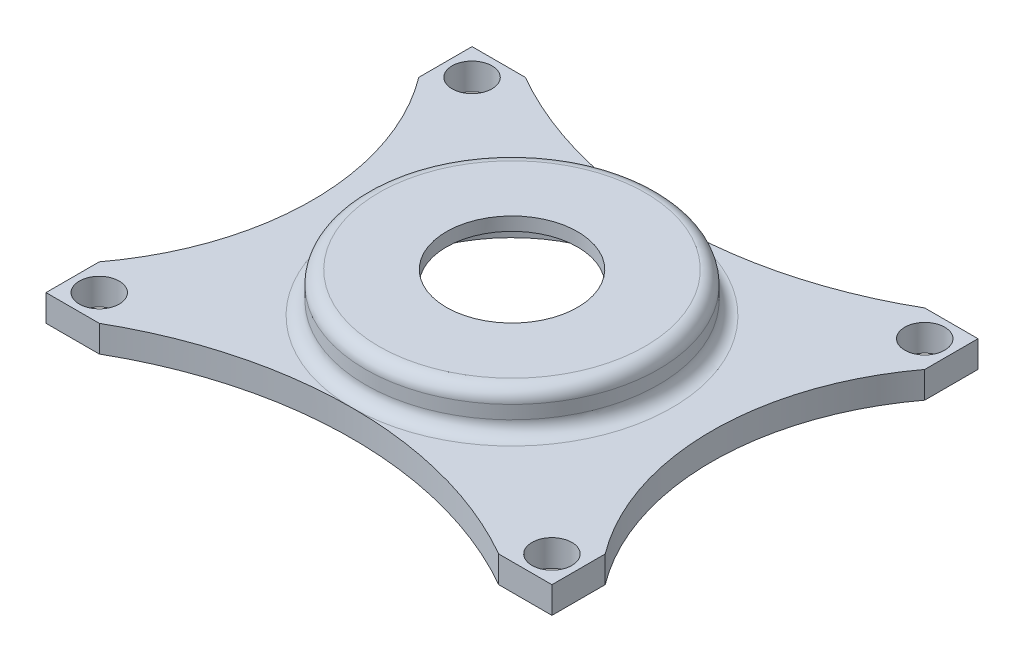
from build123d import *

# Parameters (mm, degrees)
SALIENTE_EXTRUIR2_DEPTH = 2
CROQUIS3_R              = 1.5000000000000002
CROQUIS3_R_2            = 1.5000000000000009
CORTAR_EXTRUIR1_DEPTH   = 2
CROQUIS4_R              = 11
SALIENTE_EXTRUIR3_DEPTH = 3
REDONDEO1_R             = 1
REDONDEO2_R             = 1
CROQUIS6_R              = 4.927466062817137
CORTAR_EXTRUIR2_DEPTH   = 3
CROQUIS7_R              = 10
CORTAR_EXTRUIR3_DEPTH   = 4
REDONDEO3_R             = 3


with BuildPart() as part:
    # Croquis2 → Saliente-Extruir2 (new body)
    with BuildSketch(Plane(origin=(0, 0, 0), x_dir=(1, 0, 0), z_dir=(0, 1, 0))):
        with BuildLine():
            Line((-19.000000000000007, -12), (-19, -16))
            Line((-19, -16), (-15, -16))
            ThreePointArc((-15, -16), (1.84e-15, -12.000000000000014), (15, -16))
            Line((15, -16), (19, -16))
            Line((19, -16), (19, -12))
            ThreePointArc((19, -12), (15.000000000000014, -2.45e-15), (19, 12))
            Line((19, 12), (19, 16))
            Line((19, 16), (15, 16))
            ThreePointArc((15, 16), (1.84e-15, 12.000000000000014), (-15, 16))
            Line((-15, 16), (-19, 16))
            Line((-19, 16), (-19.000000000000007, 12))
            ThreePointArc((-19.000000000000007, 12), (-15.000000000000007, 0), (-19.000000000000007, -12))
        make_face()
    extrude(amount=SALIENTE_EXTRUIR2_DEPTH)

    # Croquis3 → Cortar-Extruir1 (cut)
    with BuildSketch(Plane(origin=(0, 2, 0), x_dir=(1, 0, 0), z_dir=(0, 1, 0))):
        with Locations((-17, 13.999999999999998)):
            Circle(CROQUIS3_R)
        with Locations((17, 14.000000000000002)):
            Circle(CROQUIS3_R_2)
        with Locations((17.000000000000004, -14.000000000000002)):
            Circle(CROQUIS3_R_2)
        with Locations((-17, -14.000000000000002)):
            Circle(CROQUIS3_R)
    extrude(amount=-CORTAR_EXTRUIR1_DEPTH, mode=Mode.SUBTRACT)

    # Croquis4 → Saliente-Extruir3 (add)
    with BuildSketch(Plane(origin=(0, 2, 0), x_dir=(1, 0, 0), z_dir=(0, 1, 0))):
        Circle(CROQUIS4_R)
    extrude(amount=SALIENTE_EXTRUIR3_DEPTH)

    # Redondeo1
    redondeo1_edges = [part.edges().sort_by_distance(p)[0] for p in [
        (-11, 5, -6.23e-15),
    ]]
    fillet(redondeo1_edges, radius=REDONDEO1_R)

    # Redondeo2
    redondeo2_edges = [part.edges().sort_by_distance(p)[0] for p in [
        (-11, 2, -6.23e-15),
    ]]
    fillet(redondeo2_edges, radius=REDONDEO2_R)

    # Croquis6 → Cortar-Extruir2 (cut)
    with BuildSketch(Plane(origin=(0, 5, 0), x_dir=(1, 0, 0), z_dir=(0, 1, 0))):
        Circle(CROQUIS6_R)
    extrude(amount=-CORTAR_EXTRUIR2_DEPTH, mode=Mode.SUBTRACT)

    # Croquis7 → Cortar-Extruir3 (cut)
    with BuildSketch(Plane.XZ):
        Circle(CROQUIS7_R)
    extrude(amount=-CORTAR_EXTRUIR3_DEPTH, mode=Mode.SUBTRACT)

    # Redondeo3
    redondeo3_edges = [part.edges().sort_by_distance(p)[0] for p in [
        (-10, 4, 1.22e-15),
    ]]
    fillet(redondeo3_edges, radius=REDONDEO3_R)


solid = part.part
